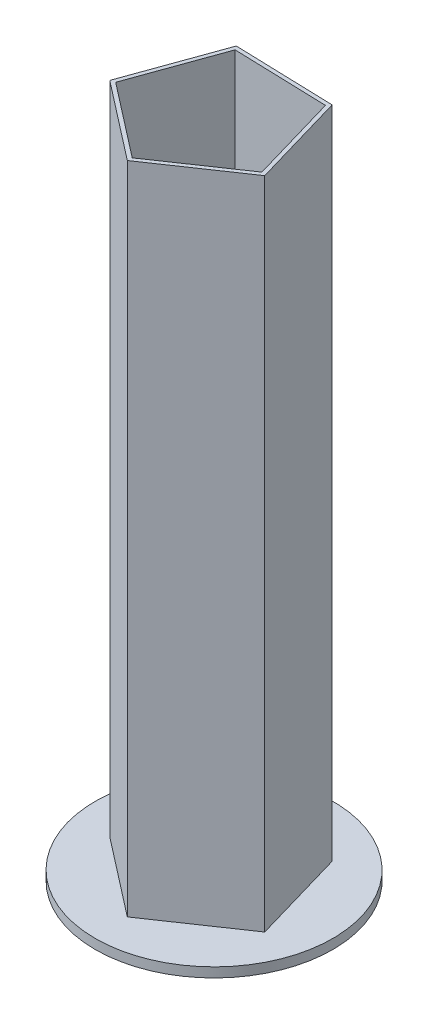
from build123d import *

# Parameters (mm, degrees)
SKETCH1_R           = 37
BOSS_EXTRUDE1_DEPTH = 3
BOSS_EXTRUDE2_DEPTH = 204


with BuildPart() as part:
    # Sketch1 → Boss-Extrude1 (new body)
    with BuildSketch(Plane(origin=(0, 0, 0), x_dir=(1, 0, 0), z_dir=(0, 1, 0))):
        Circle(SKETCH1_R)
    extrude(amount=BOSS_EXTRUDE1_DEPTH)

    # Sketch2 → Boss-Extrude2 (add)
    with BuildSketch(Plane(origin=(0, 3, 0), x_dir=(1, 0, 0), z_dir=(0, 1, 0))):
        Polygon((16.057874318, 20.708159956), (-14.732474409, 21.671119357), (-25.163044241, -7.314671619), (-0.819142193, -26.191835034), (24.656786525, -8.872772659), align=None)
        Polygon((23.261119363, -8.370540245), (15.148938036, 19.535999959), (-13.898560763, 20.444452223), (-23.738720982, -6.900633603), (-0.772775653, -24.709278334), align=None, mode=Mode.SUBTRACT)
    extrude(amount=BOSS_EXTRUDE2_DEPTH)


solid = part.part
